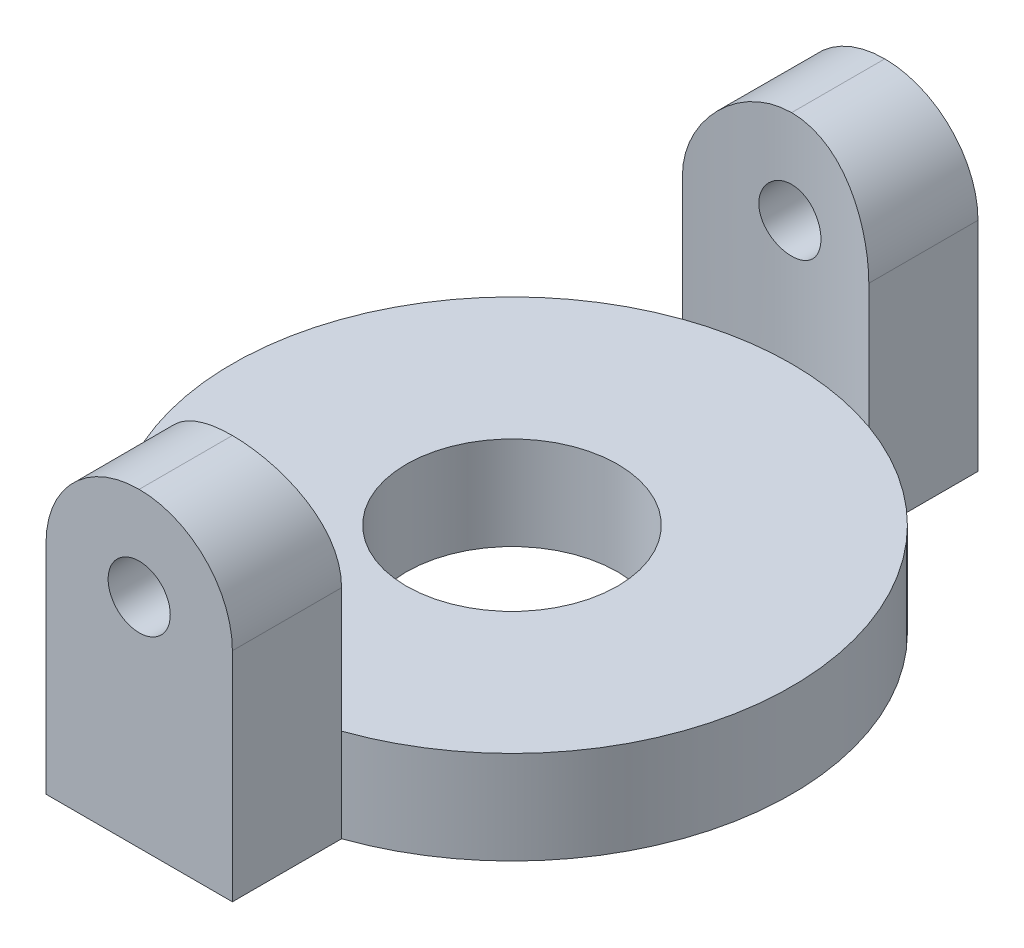
from build123d import *

# Parameters (mm, degrees)
SKETCH1_R           = 4.5
SKETCH1_R_2         = 1.7
BOSS_EXTRUDE1_DEPTH = 1.5
BOSS_EXTRUDE2_DEPTH = 5
SKETCH4_R           = 0.5
CUT_EXTRUDE1_DEPTH  = 14.756816492
FILLET1_R           = 1.5


with BuildPart() as part:
    # Sketch1 → Boss-Extrude1 (new body)
    with BuildSketch(Plane(origin=(0, 0, 0), x_dir=(1, 0, 0), z_dir=(0, 1, 0))):
        with Locations(Location((0, 0, 0), (0, 0, 270))):
            Circle(SKETCH1_R)
        with Locations(Location((0, 0, 0), (0, 0, 270))):
            Circle(SKETCH1_R_2, mode=Mode.SUBTRACT)
    extrude(amount=BOSS_EXTRUDE1_DEPTH)

    # Sketch3 → Boss-Extrude2 (add)
    with BuildSketch(Plane(origin=(0, 0, 0), x_dir=(1, 0, 0), z_dir=(0, 1, 0))):
        with BuildLine():
            Line((-1.5, -4.242640687), (-1.5, -6))
            Line((-1.5, -6), (1.5, -6))
            Line((1.5, -6), (1.5, -4.242640687))
            ThreePointArc((1.5, -4.242640687), (0, -4.5), (-1.5, -4.242640687))
        make_face()
        with BuildLine():
            Line((-1.5, 6), (1.5, 6))
            Line((1.5, 6), (1.5, 4.242640687))
            ThreePointArc((1.5, 4.242640687), (0, 4.5), (-1.5, 4.242640687))
            Line((-1.5, 4.242640687), (-1.5, 6))
        make_face()
    extrude(amount=BOSS_EXTRUDE2_DEPTH)

    # Sketch4 → Cut-Extrude1 (cut, through all)
    with BuildSketch(Plane.XY.offset(6)):
        with Locations((0, 3.5)):
            Circle(SKETCH4_R)
    extrude(amount=-CUT_EXTRUDE1_DEPTH, mode=Mode.SUBTRACT)

    # Fillet1
    fillet1_edges = [part.edges().sort_by_distance(p)[0] for p in [
        (1.5, 5, 5.121320344),
        (-1.5, 5, 5.121320344),
        (1.5, 5, -5.121320344),
        (-1.5, 5, -5.121320344),
    ]]
    fillet(fillet1_edges, radius=FILLET1_R - 0.0001)  # a hair under: the kernel refuses the full size


solid = part.part
